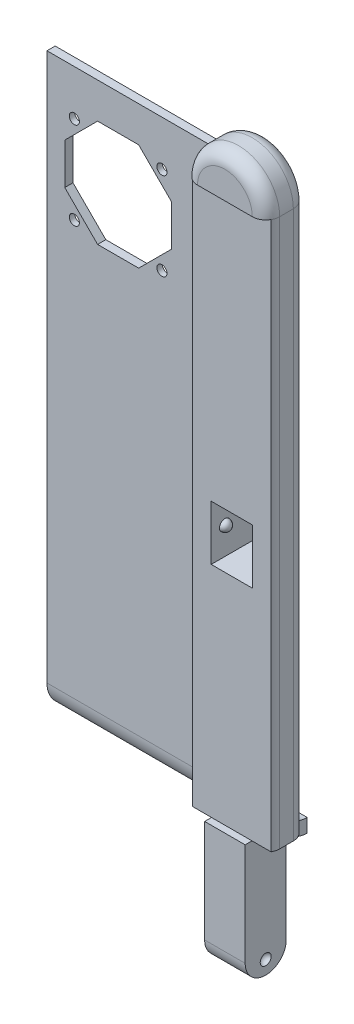
from build123d import *

# Parameters (mm, degrees)
BOSS_EXTRUDE1_DEPTH = 7.5
FILLET1_R           = 5
SKETCH2_W           = 15
SKETCH2_H           = 20
CUT_EXTRUDE1_DEPTH  = 152.492574075
FILLET6_R           = 5
CUT_EXTRUDE2_DEPTH  = 152.848641746
BOSS_EXTRUDE2_DEPTH = 80
BOSS_EXTRUDE3_START = 5
BOSS_EXTRUDE3_DEPTH = 5
SKETCH12_W          = 12.5
SKETCH12_H          = 20
CUT_EXTRUDE3_DEPTH  = 3
SKETCH13_W          = 2.5
SKETCH13_H          = 200
CUT_EXTRUDE4_DEPTH  = 160.863222787
SKETCH14_R          = 1.85
CUT_EXTRUDE5_DEPTH  = 10
SKETCH15_R          = 3.25
CUT_EXTRUDE6_DEPTH  = 1


with BuildPart() as part:
    # Sketch1 → Boss-Extrude1 (new, symmetric)
    with BuildSketch(Plane.XY):
        with BuildLine():
            Line((-15, 100), (-15, -100))
            Line((-15, -100), (-7.4, -100))
            Line((-7.4, -100), (-7.4, -150))
            Line((-7.4, -150), (7.4, -150))
            Line((7.4, -150), (7.4, -100))
            Line((7.4, -100), (15, -100))
            Line((15, -100), (15, 100))
            ThreePointArc((15, 100), (0, 115), (-15, 100))
        make_face()
    extrude(amount=BOSS_EXTRUDE1_DEPTH, both=True)

    # Fillet1
    fillet1_edges = [part.edges().sort_by_distance(p)[0] for p in [
        (-15, 0, -7.5),
        (0, 115, -7.5),
        (-15, 0, 7.5),
        (0, 115, 7.5),
        (15, 0, -7.5),
        (15, 0, 7.5),
    ]]
    fillet(fillet1_edges, radius=FILLET1_R)

    # Sketch2 → Cut-Extrude1 (cut, through all)
    with BuildSketch(Plane.XY.offset(7.5)):
        with Locations((0, -10)):
            Rectangle(SKETCH2_W, SKETCH2_H)
    extrude(amount=-CUT_EXTRUDE1_DEPTH, mode=Mode.SUBTRACT)

    # Sketch5 → Cut-Revolve1 (revolve, cut)
    with BuildSketch(Plane.XY):
        with BuildLine():
            Line((-7.4, -140), (-5.4, -140))
            ThreePointArc((-5.4, -140), (-5.985786438, -138.585786438), (-7.4, -138))
            Line((-7.4, -138), (-7.4, -140))
        make_face()
        with BuildLine():
            Line((7.4, -140), (5.4, -140))
            ThreePointArc((5.4, -140), (5.985786438, -138.585786438), (7.4, -138))
            Line((7.4, -138), (7.4, -140))
        make_face()
    revolve(axis=Axis((-35.580304025, -140, 0), (1, 0, 0)), mode=Mode.SUBTRACT)

    # Fillet6
    fillet6_edges = [part.edges().sort_by_distance(p)[0] for p in [
        (-7.4, -150, 0),
        (7.4, -150, 0),
    ]]
    fillet(fillet6_edges, radius=FILLET6_R)

    # Sketch7 → Cut-Extrude2 (cut, through all)
    with BuildSketch(Plane(origin=(7.4, 0, 0), x_dir=(0, 0, -1), z_dir=(1, 0, 0))):
        with BuildLine():
            Line((-7.5, -137.5), (-7.5, -150))
            Line((-7.5, -150), (7.5, -150))
            Line((7.5, -150), (7.5, -137.5))
            ThreePointArc((7.5, -137.5), (0, -145), (-7.5, -137.5))
        make_face()
    extrude(amount=-CUT_EXTRUDE2_DEPTH, mode=Mode.SUBTRACT)

    # Sketch9 → Revolve2 (revolve)
    with BuildSketch(Plane.XY):
        with BuildLine():
            Line((-7.5, -10), (-5.5, -10))
            ThreePointArc((-5.5, -10), (-6.085786438, -8.585786438), (-7.5, -8))
            Line((-7.5, -8), (-7.5, -10))
        make_face()
        with BuildLine():
            Line((7.5, -10), (5.5, -10))
            ThreePointArc((5.5, -10), (6.085786438, -8.585786438), (7.5, -8))
            Line((7.5, -8), (7.5, -10))
        make_face()
    revolve(axis=Axis((-32.251262552, -10, 0), (1, 0, 0)))

    # Sketch10 → Boss-Extrude2 (add)
    with BuildSketch(Plane(origin=(0, 0, 0), x_dir=(0, 0, -1), z_dir=(1, 0, 0))):
        with BuildLine():
            Line((7.5, -100), (7.5, 100))
            Line((7.5, 100), (10.5, 100))
            Line((10.5, 100), (10.5, -98.519259302))
            ThreePointArc((10.5, -98.519259302), (12.584119567, -103.288955309), (17.5, -105))
            Line((17.5, -105), (17.5, -110))
            ThreePointArc((17.5, -110), (10.428932188, -107.071067812), (7.5, -100))
        make_face()
    extrude(amount=-BOSS_EXTRUDE2_DEPTH)

    # Sketch11 → Boss-Extrude3 (add)
    with BuildSketch(Plane(origin=(0, 0, 0), x_dir=(0, 0, -1), z_dir=(1, 0, 0)).offset(BOSS_EXTRUDE3_START)):
        with BuildLine():
            Line((17.5, -110), (17.5, -105))
            ThreePointArc((17.5, -105), (12.584119567, -103.288955309), (10.5, -98.519259302))
            Line((10.5, -98.519259302), (10.5, 100))
            Line((10.5, 100), (7.5, 100))
            Line((7.5, 100), (7.5, -100))
            ThreePointArc((7.5, -100), (10.428932188, -107.071067812), (17.5, -110))
        make_face()
    extrude(amount=-BOSS_EXTRUDE3_DEPTH)

    # Sketch12 → Cut-Extrude3 (cut)
    with BuildSketch(Plane(origin=(0, 0, -10.5), x_dir=(-1, 0, 0), z_dir=(0, 0, -1))):
        with Locations((1.25, -10)):
            Rectangle(SKETCH12_W, SKETCH12_H)
    extrude(amount=-CUT_EXTRUDE3_DEPTH, mode=Mode.SUBTRACT)

    # Sketch13 → Cut-Extrude4 (cut, through all)
    with BuildSketch(Plane.ZY.offset(15)):
        with Locations((6.25, 0)):
            Rectangle(SKETCH13_W, SKETCH13_H)
    extrude(amount=-CUT_EXTRUDE4_DEPTH, mode=Mode.SUBTRACT)

    # Sketch14 → Cut-Extrude5 (cut)
    with BuildSketch(Plane(origin=(0, 0, -10.5), x_dir=(-1, 0, 0), z_dir=(0, 0, -1))):
        with Locations((70, 51.480740698)):
            Circle(SKETCH14_R)
        with Locations((70, 83.480740698)):
            Circle(SKETCH14_R)
        with Locations((38, 83.480740698)):
            Circle(SKETCH14_R)
        with Locations((38, 51.480740698)):
            Circle(SKETCH14_R)
        Polygon((61.5, 86.980740698), (46.5, 86.980740698), (34.5, 74.980740698), (34.5, 59.980740698), (46.5, 47.980740698), (61.5, 47.980740698), (73.5, 59.980740698), (73.5, 74.980740698), align=None)
    extrude(amount=-CUT_EXTRUDE5_DEPTH, mode=Mode.SUBTRACT)

    # Sketch15 → Cut-Extrude6 (cut)
    with BuildSketch(Plane(origin=(0, 0, -10.5), x_dir=(-1, 0, 0), z_dir=(0, 0, -1))):
        with Locations((70, 83.480740698)):
            Circle(SKETCH15_R)
        with Locations((38, 83.480740698)):
            Circle(SKETCH15_R)
        with Locations((38, 51.480740698)):
            Circle(SKETCH15_R)
        with Locations((70, 51.480740698)):
            Circle(SKETCH15_R)
    extrude(amount=-CUT_EXTRUDE6_DEPTH, mode=Mode.SUBTRACT)


solid = part.part
